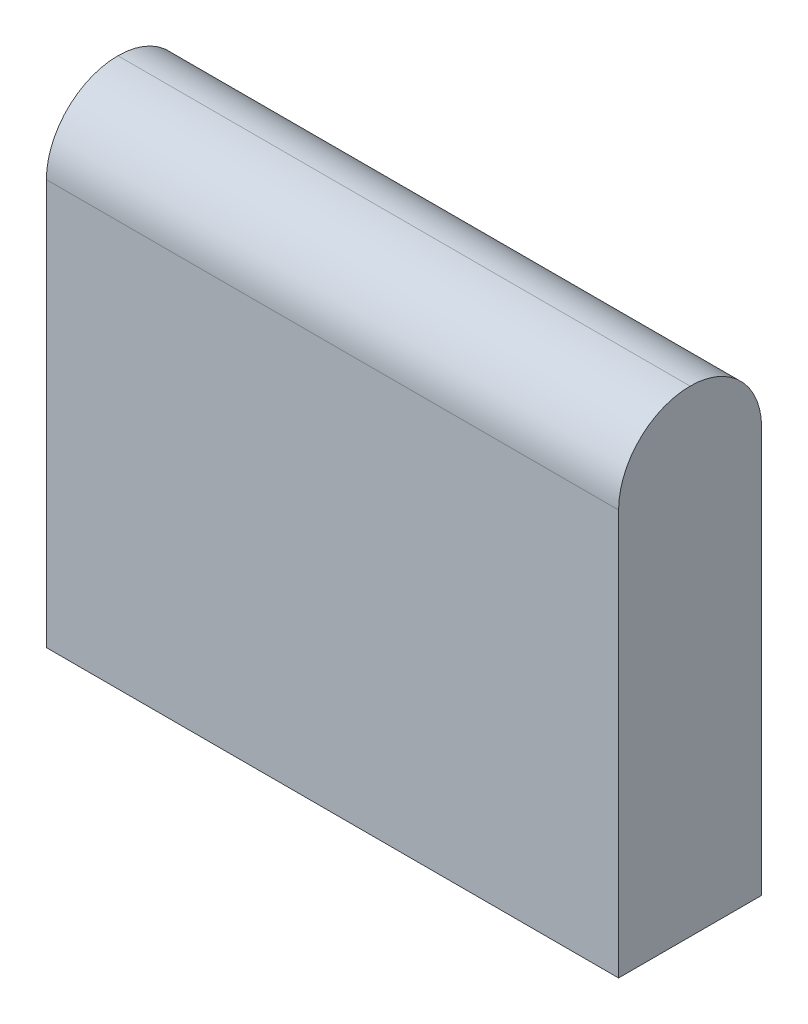
from build123d import *

# Parameters (mm, degrees)
MAIN_DEPTH            = 4.7625
MAIN_DEPTH_BACK       = 4.7625
SKETCH1_W             = 38.1
SKETCH1_H             = 31.75
FILLET_2_R            = 4.7625
SERVOHORNPOCKET_DEPTH = 3.81


with BuildPart() as part:
    # Sketch1 → Main (new, two sides: drawn at the far end of the back side and taken through both)
    with BuildSketch(Plane.XY.offset(-MAIN_DEPTH_BACK)):
        with Locations((0, -7.9375)):
            Rectangle(SKETCH1_W, SKETCH1_H)
    extrude(amount=MAIN_DEPTH + MAIN_DEPTH_BACK)

    # Fillet 2
    fillet_2_edges = [part.edges().sort_by_distance(p)[0] for p in [
        (0, 7.9375, -4.7625),
        (0, 7.9375, 4.7625),
    ]]
    fillet(fillet_2_edges, radius=FILLET_2_R - 0.0001)  # a hair under: the kernel refuses the full size

    # Sketch2 → ServoHornPocket (cut)
    with BuildSketch(Plane.ZY.offset(19.05)):
        with BuildLine():
            Line((3.681584666, 2.768121212), (2.240359567, -10.272598485))
            ThreePointArc((2.240359567, -10.272598485), (0, -12.279), (-2.240359567, -10.272598485))
            Line((-2.240359567, -10.272598485), (-3.530690742, 4.294749474))
            ThreePointArc((-3.530690742, 4.294749474), (0.767033706, 6.798710156), (3.681584666, 2.768121212))
        make_face()
    extrude(amount=-SERVOHORNPOCKET_DEPTH, mode=Mode.SUBTRACT)


solid = part.part
